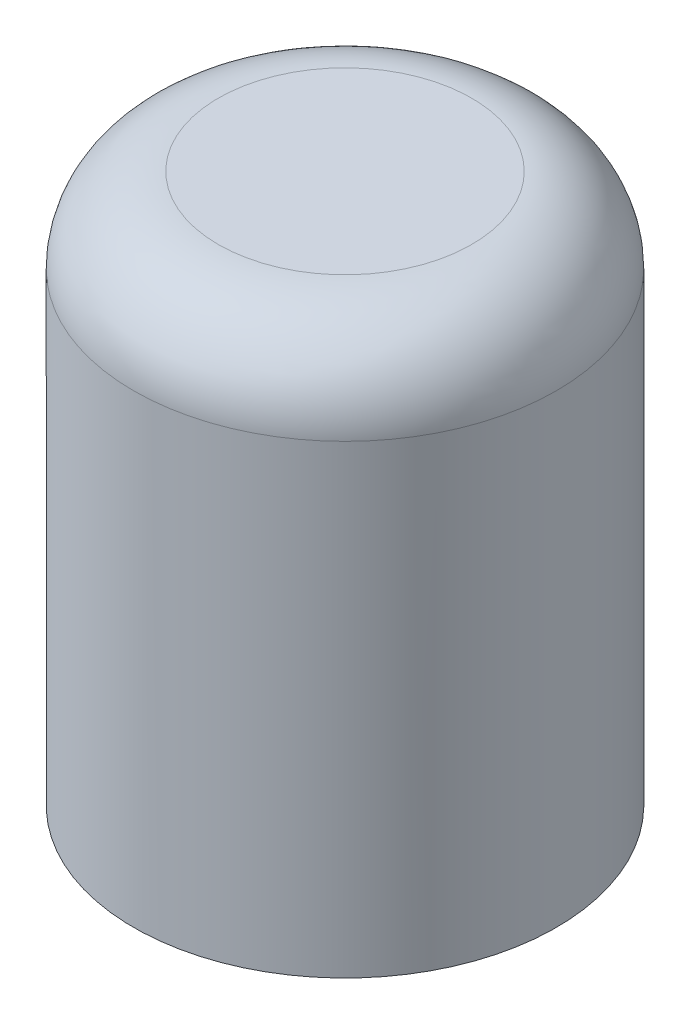
from build123d import *

# Parameters (mm, degrees)
SKETCH1_R           = 5
BOSS_EXTRUDE1_DEPTH = 13
CUT_EXTRUDE1_DEPTH  = 12
FILLET4_R           = 2
FILLET5_R           = 0.5
FILLET6_R           = 2


with BuildPart() as part:
    # Sketch1 → Boss-Extrude1 (new body)
    with BuildSketch(Plane(origin=(0, 0, 0), x_dir=(1, 0, 0), z_dir=(0, 1, 0))):
        with Locations(Location((0, 0, 0), (0, 0, 90))):
            Circle(SKETCH1_R)
    extrude(amount=BOSS_EXTRUDE1_DEPTH)

    # Insert → Cut-Extrude1 (cut)
    with BuildSketch(Plane.XZ):
        with BuildLine():
            Line((-1.75, 2.738612788), (-1.75, -2.738612788))
            ThreePointArc((-1.75, -2.738612788), (3.25, 0), (-1.75, 2.738612788))
        make_face()
    extrude(amount=-CUT_EXTRUDE1_DEPTH, mode=Mode.SUBTRACT)

    # Fillet4
    # the kernel refuses this fillet: 2 mm, written as the material it adds along each edge
    with BuildSketch(Plane(origin=(0, 12, 0), x_dir=(-0.9999950652018582, 0, -0.0031415874858799196), z_dir=(-0.0031415874858799196, 0, 0.9999950652018582))) as fillet4_piece_1:
        with BuildLine():
            CenterArc((3.25 - FILLET4_R, FILLET4_R), FILLET4_R, 270, 90)
            Line((3.25 - FILLET4_R, 0), (3.25, 0))
            Line((3.25, 0), (3.25, FILLET4_R))
        make_face()
    revolve(axis=Axis((0, 12, 0), (0, -1, 0)), revolution_arc=359.64)
    with BuildSketch(Plane(origin=(-1.75, 12, 7.738612788), x_dir=(0, -1, 0), z_dir=(0, 0, -1))) as fillet4_piece_2_section:
        with BuildLine():
            CenterArc((FILLET4_R, -FILLET4_R), FILLET4_R, 90, 90)
            Line((0, -FILLET4_R), (0, 0))
            Line((0, 0), (FILLET4_R, 0))
        make_face()
    fillet4_piece_2 = extrude(amount=15.477225575, mode=Mode.PRIVATE)
    fillet4_piece_2 = fillet4_piece_2 & Plane(origin=(0, 11.564510451, 0), x_dir=(-0.5384615384615385, 0, -0.8426500884694863), z_dir=(0, -1, 0)) * Cylinder(3.25, 39, mode=Mode.PRIVATE)
    add(fillet4_piece_2)

    # Fillet5
    fillet5_edges = [part.edges().sort_by_distance(p)[0] for p in [
        (3.25, 0, 0),
        (-1.75, 0, 0),
    ]]
    fillet(fillet5_edges, radius=FILLET5_R)

    # Fillet6
    fillet6_edges = [part.edges().sort_by_distance(p)[0] for p in [
        (0, 13, 5),
    ]]
    fillet(fillet6_edges, radius=FILLET6_R)


solid = part.part
